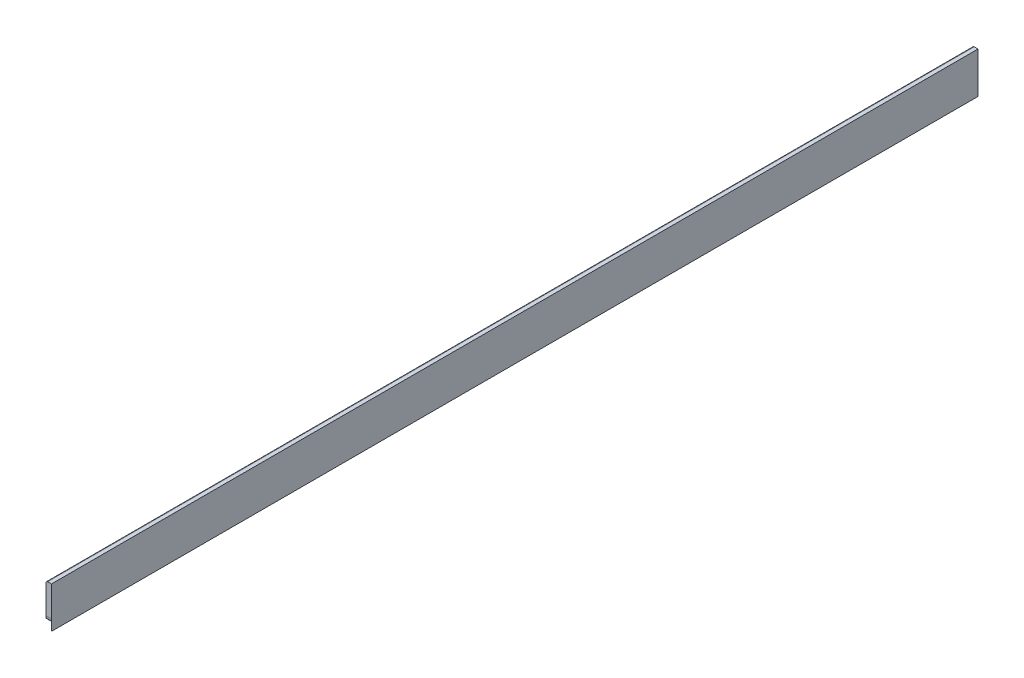
from build123d import *

# Parameters (mm, degrees)
EXTRUDE_1_DEPTH = 338
OTHER_START     = -31
OTHER_1_DEPTH   = 5
OTHER_START_2   = -24.7
OTHER_1_2_DEPTH = 20.7
OTHER_START_3   = -1
OTHER_1_3_DEPTH = 5
OTHER_START_4   = 4
OTHER_1_4_DEPTH = 4
OTHER_START_5   = -4
OTHER_1_5_DEPTH = 4
OTHER_START_6   = -26
OTHER_1_6_DEPTH = 18


with BuildPart() as part:
    # Эскиз1 → Бобышка-Вытянуть1 (new body)
    with BuildSketch(Plane.XY):
        with BuildLine():
            Line((0, 0), (0, 30))
            Line((0, 30), (-2.7, 30))
            ThreePointArc((-2.7, 30), (-3.619238816, 29.619238816), (-4, 28.7))
            Line((-4, 28.7), (-4, 8))
            ThreePointArc((-4, 8), (-5.171572875, 5.171572875), (-8, 4))
            Line((-8, 4), (-28.7, 4))
            ThreePointArc((-28.7, 4), (-29.619238816, 3.619238816), (-30, 2.7))
            Line((-30, 2.7), (-30, 0))
            Line((-30, 0), (0, 0))
        make_face()
    extrude(amount=-EXTRUDE_1_DEPTH)

    # Полость1: read off the stored shape, not the designer's step
    # Полость1 outline → Полость1 (cut)
    with BuildSketch(Plane.YZ.offset(OTHER_START)):
        with BuildLine():
            Line((4, -338), (4, -313.3))
            ThreePointArc((4, -313.3), (3.619238816, -312.380761184), (2.7, -312))
            Line((2.7, -312), (0, -312))
            Line((0, -312), (0, -338))
            Line((0, -338), (4, -338))
        make_face()
    extrude(amount=OTHER_1_DEPTH, mode=Mode.SUBTRACT)

    # Other 1 2 outline → Other 1 2 (cut)
    with BuildSketch(Plane.YZ.offset(OTHER_START_2)):
        with BuildLine():
            ThreePointArc((8, -338), (5.171572875, -336.828427125), (4, -334))
            Line((4, -334), (4, -338))
            Line((4, -338), (8, -338))
        make_face()
    extrude(amount=OTHER_1_2_DEPTH, mode=Mode.SUBTRACT)

    # Other 1 3 outline → Other 1 3 (cut)
    with BuildSketch(Plane(origin=(0, 0, 0), x_dir=(1, 0, 0), z_dir=(0, 1, 0)).offset(OTHER_START_3)):
        Polygon((0, 338), (-26, 338), (-26, 312), align=None)
    extrude(amount=OTHER_1_3_DEPTH, mode=Mode.SUBTRACT)

    # Other 1 4 outline → Other 1 4 (cut)
    with BuildSketch(Plane(origin=(0, 0, 0), x_dir=(1, 0, 0), z_dir=(0, 1, 0)).offset(OTHER_START_4)):
        Polygon((-4, 334), (0, 338), (-4, 338), align=None)
    extrude(amount=OTHER_1_4_DEPTH, mode=Mode.SUBTRACT)

    # Other 1 5 outline → Other 1 5 (add)
    with BuildSketch(Plane.YZ.offset(OTHER_START_5)):
        with BuildLine():
            ThreePointArc((4, -334), (5.171572875, -336.828427125), (8, -338))
            Line((8, -338), (8, -311))
            Line((8, -311), (4.000000005, -311))
            Line((4.000000005, -311), (4, -334))
        make_face()
    extrude(amount=OTHER_1_5_DEPTH)

    # Other 1 6 outline → Other 1 6 (add)
    with BuildSketch(Plane.YZ.offset(OTHER_START_6)):
        with BuildLine():
            ThreePointArc((2.7, -312), (3.619238816, -312.380761184), (4, -313.3))
            Line((4, -313.3), (4.000000005, -311))
            Line((4.000000005, -311), (2, -311))
            Line((2, -311), (2, -312.000000001))
            Line((2, -312.000000001), (2.7, -312))
        make_face()
    extrude(amount=OTHER_1_6_DEPTH)

    # Зеркальное отражение1: part across plane


with BuildPart() as part_1:
    add(part.part)
    add(part.part.mirror(Plane(origin=(-2.7, 28.7, 0), x_dir=(1, 0, 0), z_dir=(0, 0, 1))))


solid = part_1.part
